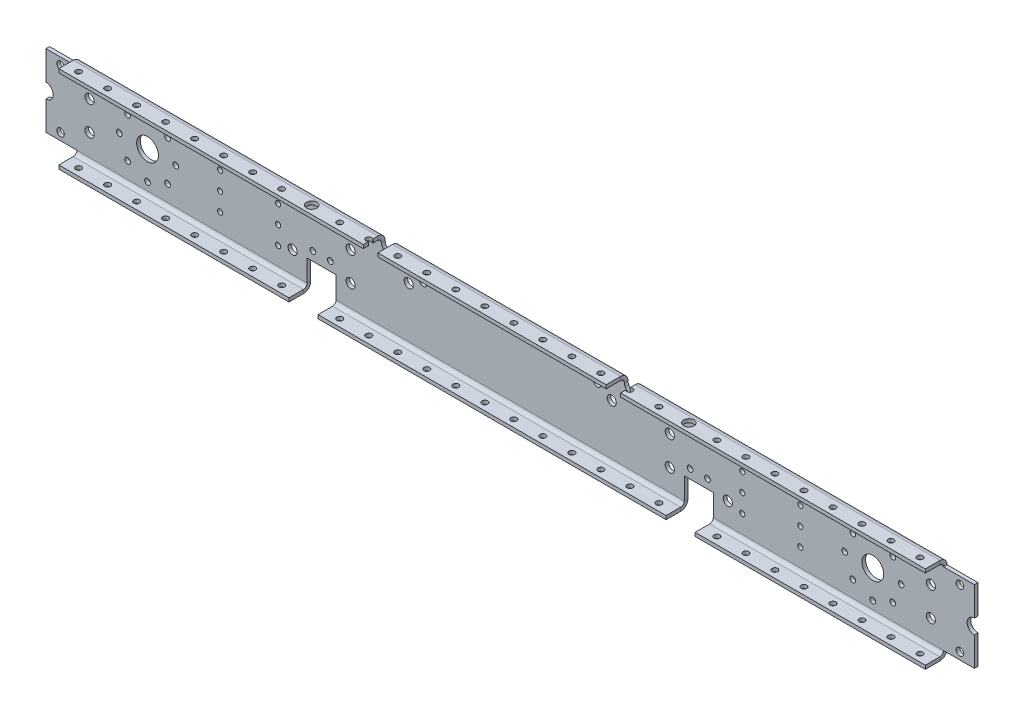
from build123d import *

# Parameters (mm, degrees)
SKETCH11_W                 = 812.8
SKETCH11_H                 = 63.5
BASE_FLANGE1_DEPTH         = 3.175
SKETCH16_W                 = 25.4
SKETCH16_H                 = 19.05
CUT_EXTRUDE1_DEPTH         = 816.802024467
SKETCH17_W                 = 25.4
SKETCH17_H                 = 19.05
CUT_EXTRUDE2_DEPTH         = 816.802024467
M18_CLEARANCE_HOLE1_D      = 19.05
F_5_0_5_DIAMETER_HOLE1_D   = 5
M4_CLEARANCE_HOLE1_D       = 4.4958
F_6_6_6_6_DIAMETER_HOLE1_D = 6.6
F_8_0_8_DIAMETER_HOLE1_D   = 8
HOLE1_D                    = 12.7
EDGE_FLANGE1_DEPTH         = 201.549
EDGE_FLANGE1_START         = 3.175
EDGE_FLANGE1_PROFILE_W     = 201.549
EDGE_FLANGE1_PROFILE_H     = 12.7
EDGE_FLANGE1_PROFILE_R     = 2.5
EDGE_FLANGE1_FLAT_DEPTH    = 3.175
EDGE_FLANGE2_DEPTH         = 304.8
EDGE_FLANGE2_START         = 3.175
EDGE_FLANGE2_PROFILE_W     = 304.8
EDGE_FLANGE2_PROFILE_H     = 12.7
EDGE_FLANGE2_PROFILE_R     = 2.5
EDGE_FLANGE2_FLAT_DEPTH    = 3.175
EDGE_FLANGE3_DEPTH         = 201.549
EDGE_FLANGE3_START         = 3.175
EDGE_FLANGE3_PROFILE_W     = 201.549
EDGE_FLANGE3_PROFILE_H     = 12.7
EDGE_FLANGE3_PROFILE_R     = 2.5
EDGE_FLANGE3_FLAT_DEPTH    = 3.175
EDGE_FLANGE4_DEPTH         = 266.7
EDGE_FLANGE4_START         = 3.175
EDGE_FLANGE4_PROFILE_R     = 2.5
EDGE_FLANGE4_PROFILE_R_2   = 4.5
EDGE_FLANGE4_FLAT_DEPTH    = 3.175
EDGE_FLANGE5_DEPTH         = 199.898
EDGE_FLANGE5_START         = 3.175
EDGE_FLANGE5_PROFILE_W     = 199.898
EDGE_FLANGE5_PROFILE_H     = 12.7
EDGE_FLANGE5_PROFILE_R     = 2.5
EDGE_FLANGE5_FLAT_DEPTH    = 3.175
EDGE_FLANGE6_DEPTH         = 266.7
EDGE_FLANGE6_START         = 3.175
EDGE_FLANGE6_PROFILE_R     = 4.5
EDGE_FLANGE6_PROFILE_R_2   = 2.5
EDGE_FLANGE6_FLAT_DEPTH    = 3.175


# Sheet-metal steps are written as plain solids
with BuildPart() as part:
    # Sketch11 → Base-Flange1 (new body)
    with BuildSketch(Plane.XY.offset(3.175)):
        with Locations((406.4, -38.1)):
            Rectangle(SKETCH11_W, SKETCH11_H)
    extrude(amount=-BASE_FLANGE1_DEPTH)

    # Sketch16 → Cut-Extrude1 (cut, through all)
    with BuildSketch(Plane(origin=(0, 0, 0), x_dir=(-1, 0, 0), z_dir=(0, 0, -1))):
        with Locations((-241.3, -60.325)):
            Rectangle(SKETCH16_W, SKETCH16_H)
    extrude(amount=-CUT_EXTRUDE1_DEPTH, mode=Mode.SUBTRACT)

    # Sketch17 → Cut-Extrude2 (cut, through all)
    with BuildSketch(Plane(origin=(0, 0, 0), x_dir=(-1, 0, 0), z_dir=(0, 0, -1))):
        with Locations((-571.5, -60.325)):
            Rectangle(SKETCH17_W, SKETCH17_H)
    extrude(amount=-CUT_EXTRUDE2_DEPTH, mode=Mode.SUBTRACT)

    # M18 Clearance Hole1 (through all)
    with Locations(Plane(origin=(0, 0, 0), x_dir=(-1, 0, 0), z_dir=(0, 0, -1))):
        with Locations((-723.9, -38.1), (-88.9, -38.1)):
            Hole(M18_CLEARANCE_HOLE1_D / 2)

    # Ø5.0 (5) Diameter Hole1 (through all)
    with Locations(Plane(origin=(0, 0, 0), x_dir=(-1, 0, 0), z_dir=(0, 0, -1))):
        with Locations((-233.68, -42.8625), (-248.92, -42.8625), (-699.15, -38.1), (-748.65, -38.1), (-741.400892834, -55.600892834), (-706.399107166, -20.599107166), (-706.399107166, -55.600892834), (-741.400892834, -20.599107166), (-723.9, -62.85), (-723.9, -13.35), (-113.65, -38.1), (-64.15, -38.1), (-71.399107166, -55.600892834), (-106.400892834, -20.599107166), (-106.400892834, -55.600892834), (-71.399107166, -20.599107166), (-88.9, -62.85), (-88.9, -13.35), (-563.88, -42.8625), (-579.12, -42.8625)):
            Hole(F_5_0_5_DIAMETER_HOLE1_D / 2)

    # M4 Clearance Hole1 (through all)
    with Locations(Plane(origin=(0, 0, 0), x_dir=(-1, 0, 0), z_dir=(0, 0, -1))):
        with Locations((-152.4, -38.1), (-203.2, -38.1), (-152.4, -22.225), (-152.4, -53.975), (-203.2, -53.975), (-203.2, -22.225), (-609.6, -22.225), (-609.6, -53.975), (-660.4, -53.975), (-660.4, -22.225), (-609.6, -38.1), (-660.4, -38.1)):
            Hole(M4_CLEARANCE_HOLE1_D / 2)

    # Ø6.6 (6.6) Diameter Hole1 (through all)
    with Locations(Plane(origin=(0, 0, 0), x_dir=(-1, 0, 0), z_dir=(0, 0, -1))):
        with Locations((-800.1, -63.5), (-482.6, -18.218319194), (-800.1, -12.7), (-12.7, -63.5), (-330.2, -18.218319194), (-12.7, -12.7)):
            Hole(F_6_6_6_6_DIAMETER_HOLE1_D / 2)

    # Ø8.0 (8) Diameter Hole1 (through all)
    with Locations(Plane(origin=(0, 0, 0), x_dir=(-1, 0, 0), z_dir=(0, 0, -1))):
        with Locations((-596.9, -50.8), (-317.5, -25.4), (-38.1, -25.4), (-215.9, -50.8), (-495.3, -25.4), (-774.7, -50.8), (-546.1, -50.8), (-266.7, -25.4), (-38.1, -50.8), (-266.7, -50.8), (-546.1, -25.4), (-774.7, -25.4)):
            Hole(F_8_0_8_DIAMETER_HOLE1_D / 2)

    # Hole1 (through all)
    with Locations(Plane.XY.offset(3.175)):
        with Locations((512.699, -6.35), (300.101, -6.35), (0, -38.1), (812.8, -38.1)):
            Hole(HOLE1_D / 2)

    # Edge-Flange1 bend section (across the edge) → Edge-Flange1 (add)
    with BuildSketch(Plane(origin=(584.2, -73.025, 3.175), x_dir=(0, 1, 0), z_dir=(1, 0, 0))):
        with BuildLine():
            Line((-3.175, 3.175), (0, 3.175))
            ThreePointArc((0, 3.175), (0.92993597, 0.92993597), (3.175, 0))
            Line((3.175, 0), (3.175, -3.175))
            ThreePointArc((3.175, -3.175), (-1.315128061, -1.315128061), (-3.175, 3.175))
        make_face()
    extrude(amount=EDGE_FLANGE1_DEPTH)

    # Edge-Flange1 profile (on flange) → Edge-Flange1 flat (add)
    with BuildSketch(Plane(origin=(0, -73.025, 3.175), x_dir=(1, 0, 0), z_dir=(0, -1, 0)).offset(EDGE_FLANGE1_START)):
        with Locations((684.9745, 9.525)):
            Rectangle(EDGE_FLANGE1_PROFILE_W, EDGE_FLANGE1_PROFILE_H)
        with Locations((774.7, 9.525)):
            Circle(EDGE_FLANGE1_PROFILE_R, mode=Mode.SUBTRACT)
        with Locations((749.3, 9.525)):
            Circle(EDGE_FLANGE1_PROFILE_R, mode=Mode.SUBTRACT)
        with Locations((723.9, 9.525)):
            Circle(EDGE_FLANGE1_PROFILE_R, mode=Mode.SUBTRACT)
        with Locations((698.5, 9.525)):
            Circle(EDGE_FLANGE1_PROFILE_R, mode=Mode.SUBTRACT)
        with Locations((673.1, 9.525)):
            Circle(EDGE_FLANGE1_PROFILE_R, mode=Mode.SUBTRACT)
        with Locations((647.7, 9.525)):
            Circle(EDGE_FLANGE1_PROFILE_R, mode=Mode.SUBTRACT)
        with Locations((622.3, 9.525)):
            Circle(EDGE_FLANGE1_PROFILE_R, mode=Mode.SUBTRACT)
        with Locations((596.9, 9.525)):
            Circle(EDGE_FLANGE1_PROFILE_R, mode=Mode.SUBTRACT)
    extrude(amount=-EDGE_FLANGE1_FLAT_DEPTH)

    # Edge-Flange2 bend section (across the edge) → Edge-Flange2 (add)
    with BuildSketch(Plane(origin=(254, -73.025, 3.175), x_dir=(0, 1, 0), z_dir=(1, 0, 0))):
        with BuildLine():
            Line((-3.175, 3.175), (0, 3.175))
            ThreePointArc((0, 3.175), (0.92993597, 0.92993597), (3.175, 0))
            Line((3.175, 0), (3.175, -3.175))
            ThreePointArc((3.175, -3.175), (-1.315128061, -1.315128061), (-3.175, 3.175))
        make_face()
    extrude(amount=EDGE_FLANGE2_DEPTH)

    # Edge-Flange2 profile (on flange) → Edge-Flange2 flat (add)
    with BuildSketch(Plane(origin=(0, -73.025, 3.175), x_dir=(1, 0, 0), z_dir=(0, -1, 0)).offset(EDGE_FLANGE2_START)):
        with Locations((406.4, 9.525)):
            Rectangle(EDGE_FLANGE2_PROFILE_W, EDGE_FLANGE2_PROFILE_H)
        with Locations((546.1, 9.525)):
            Circle(EDGE_FLANGE2_PROFILE_R, mode=Mode.SUBTRACT)
        with Locations((520.7, 9.525)):
            Circle(EDGE_FLANGE2_PROFILE_R, mode=Mode.SUBTRACT)
        with Locations((495.3, 9.525)):
            Circle(EDGE_FLANGE2_PROFILE_R, mode=Mode.SUBTRACT)
        with Locations((469.9, 9.525)):
            Circle(EDGE_FLANGE2_PROFILE_R, mode=Mode.SUBTRACT)
        with Locations((444.5, 9.525)):
            Circle(EDGE_FLANGE2_PROFILE_R, mode=Mode.SUBTRACT)
        with Locations((419.1, 9.525)):
            Circle(EDGE_FLANGE2_PROFILE_R, mode=Mode.SUBTRACT)
        with Locations((393.7, 9.525)):
            Circle(EDGE_FLANGE2_PROFILE_R, mode=Mode.SUBTRACT)
        with Locations((368.3, 9.525)):
            Circle(EDGE_FLANGE2_PROFILE_R, mode=Mode.SUBTRACT)
        with Locations((342.9, 9.525)):
            Circle(EDGE_FLANGE2_PROFILE_R, mode=Mode.SUBTRACT)
        with Locations((317.5, 9.525)):
            Circle(EDGE_FLANGE2_PROFILE_R, mode=Mode.SUBTRACT)
        with Locations((292.1, 9.525)):
            Circle(EDGE_FLANGE2_PROFILE_R, mode=Mode.SUBTRACT)
        with Locations((266.7, 9.525)):
            Circle(EDGE_FLANGE2_PROFILE_R, mode=Mode.SUBTRACT)
    extrude(amount=-EDGE_FLANGE2_FLAT_DEPTH)

    # Edge-Flange3 bend section (across the edge) → Edge-Flange3 (add)
    with BuildSketch(Plane(origin=(27.051, -73.025, 3.175), x_dir=(0, 1, 0), z_dir=(1, 0, 0))):
        with BuildLine():
            Line((-3.175, 3.175), (0, 3.175))
            ThreePointArc((0, 3.175), (0.92993597, 0.92993597), (3.175, 0))
            Line((3.175, 0), (3.175, -3.175))
            ThreePointArc((3.175, -3.175), (-1.315128061, -1.315128061), (-3.175, 3.175))
        make_face()
    extrude(amount=EDGE_FLANGE3_DEPTH)

    # Edge-Flange3 profile (on flange) → Edge-Flange3 flat (add)
    with BuildSketch(Plane(origin=(0, -73.025, 3.175), x_dir=(1, 0, 0), z_dir=(0, -1, 0)).offset(EDGE_FLANGE3_START)):
        with Locations((127.8255, 9.525)):
            Rectangle(EDGE_FLANGE3_PROFILE_W, EDGE_FLANGE3_PROFILE_H)
        with Locations((215.9, 9.525)):
            Circle(EDGE_FLANGE3_PROFILE_R, mode=Mode.SUBTRACT)
        with Locations((190.5, 9.525)):
            Circle(EDGE_FLANGE3_PROFILE_R, mode=Mode.SUBTRACT)
        with Locations((165.1, 9.525)):
            Circle(EDGE_FLANGE3_PROFILE_R, mode=Mode.SUBTRACT)
        with Locations((139.7, 9.525)):
            Circle(EDGE_FLANGE3_PROFILE_R, mode=Mode.SUBTRACT)
        with Locations((114.3, 9.525)):
            Circle(EDGE_FLANGE3_PROFILE_R, mode=Mode.SUBTRACT)
        with Locations((88.9, 9.525)):
            Circle(EDGE_FLANGE3_PROFILE_R, mode=Mode.SUBTRACT)
        with Locations((63.5, 9.525)):
            Circle(EDGE_FLANGE3_PROFILE_R, mode=Mode.SUBTRACT)
        with Locations((38.1, 9.525)):
            Circle(EDGE_FLANGE3_PROFILE_R, mode=Mode.SUBTRACT)
    extrude(amount=-EDGE_FLANGE3_FLAT_DEPTH)

    # Edge-Flange4 bend section (across the edge) → Edge-Flange4 (add)
    with BuildSketch(Plane(origin=(293.751, -3.175, 3.175), x_dir=(0, -1, 0), z_dir=(-1, 0, 0))):
        with BuildLine():
            Line((-3.175, 3.175), (0, 3.175))
            ThreePointArc((0, 3.175), (0.92993597, 0.92993597), (3.175, 0))
            Line((3.175, 0), (3.175, -3.175))
            ThreePointArc((3.175, -3.175), (-1.315128061, -1.315128061), (-3.175, 3.175))
        make_face()
    extrude(amount=EDGE_FLANGE4_DEPTH)

    # Edge-Flange4 profile (on flange) → Edge-Flange4 flat (add)
    with BuildSketch(Plane(origin=(0, -3.175, 3.175), x_dir=(-1, 0, 0), z_dir=(0, 1, 0)).offset(EDGE_FLANGE4_START)):
        with BuildLine():
            Line((-27.051, 3.175), (-27.051, 15.875))
            Line((-27.051, 15.875), (-293.751, 15.875))
            Line((-293.751, 15.875), (-293.751, 11.402285008))
            ThreePointArc((-293.751, 11.402285008), (-289.6, 9.525), (-293.751, 7.647714992))
            Line((-293.751, 7.647714992), (-293.751, 3.175))
            Line((-293.751, 3.175), (-27.051, 3.175))
        make_face()
        with Locations((-38.1, 9.525)):
            Circle(EDGE_FLANGE4_PROFILE_R, mode=Mode.SUBTRACT)
        with Locations((-63.5, 9.525)):
            Circle(EDGE_FLANGE4_PROFILE_R, mode=Mode.SUBTRACT)
        with Locations((-88.9, 9.525)):
            Circle(EDGE_FLANGE4_PROFILE_R, mode=Mode.SUBTRACT)
        with Locations((-114.3, 9.525)):
            Circle(EDGE_FLANGE4_PROFILE_R, mode=Mode.SUBTRACT)
        with Locations((-139.7, 9.525)):
            Circle(EDGE_FLANGE4_PROFILE_R, mode=Mode.SUBTRACT)
        with Locations((-165.1, 9.525)):
            Circle(EDGE_FLANGE4_PROFILE_R, mode=Mode.SUBTRACT)
        with Locations((-190.5, 9.525)):
            Circle(EDGE_FLANGE4_PROFILE_R, mode=Mode.SUBTRACT)
        with Locations((-215.9, 9.525)):
            Circle(EDGE_FLANGE4_PROFILE_R, mode=Mode.SUBTRACT)
        with Locations((-241.3, 8.693319194)):
            Circle(EDGE_FLANGE4_PROFILE_R_2, mode=Mode.SUBTRACT)
        with Locations((-266.7, 9.525)):
            Circle(EDGE_FLANGE4_PROFILE_R, mode=Mode.SUBTRACT)
    extrude(amount=-EDGE_FLANGE4_FLAT_DEPTH)

    # Edge-Flange5 bend section (across the edge) → Edge-Flange5 (add)
    with BuildSketch(Plane(origin=(506.349, -3.175, 3.175), x_dir=(0, -1, 0), z_dir=(-1, 0, 0))):
        with BuildLine():
            Line((-3.175, 3.175), (0, 3.175))
            ThreePointArc((0, 3.175), (0.92993597, 0.92993597), (3.175, 0))
            Line((3.175, 0), (3.175, -3.175))
            ThreePointArc((3.175, -3.175), (-1.315128061, -1.315128061), (-3.175, 3.175))
        make_face()
    extrude(amount=EDGE_FLANGE5_DEPTH)

    # Edge-Flange5 profile (on flange) → Edge-Flange5 flat (add)
    with BuildSketch(Plane(origin=(0, -3.175, 3.175), x_dir=(-1, 0, 0), z_dir=(0, 1, 0)).offset(EDGE_FLANGE5_START)):
        with Locations((-406.4, 9.525)):
            Rectangle(EDGE_FLANGE5_PROFILE_W, EDGE_FLANGE5_PROFILE_H)
        with Locations((-317.5, 9.525)):
            Circle(EDGE_FLANGE5_PROFILE_R, mode=Mode.SUBTRACT)
        with Locations((-342.9, 9.525)):
            Circle(EDGE_FLANGE5_PROFILE_R, mode=Mode.SUBTRACT)
        with Locations((-368.3, 9.525)):
            Circle(EDGE_FLANGE5_PROFILE_R, mode=Mode.SUBTRACT)
        with Locations((-393.7, 9.525)):
            Circle(EDGE_FLANGE5_PROFILE_R, mode=Mode.SUBTRACT)
        with Locations((-419.1, 9.525)):
            Circle(EDGE_FLANGE5_PROFILE_R, mode=Mode.SUBTRACT)
        with Locations((-444.5, 9.525)):
            Circle(EDGE_FLANGE5_PROFILE_R, mode=Mode.SUBTRACT)
        with Locations((-469.9, 9.525)):
            Circle(EDGE_FLANGE5_PROFILE_R, mode=Mode.SUBTRACT)
        with Locations((-495.3, 9.525)):
            Circle(EDGE_FLANGE5_PROFILE_R, mode=Mode.SUBTRACT)
    extrude(amount=-EDGE_FLANGE5_FLAT_DEPTH)

    # Edge-Flange6 bend section (across the edge) → Edge-Flange6 (add)
    with BuildSketch(Plane(origin=(785.749, -3.175, 3.175), x_dir=(0, -1, 0), z_dir=(-1, 0, 0))):
        with BuildLine():
            Line((-3.175, 3.175), (0, 3.175))
            ThreePointArc((0, 3.175), (0.92993597, 0.92993597), (3.175, 0))
            Line((3.175, 0), (3.175, -3.175))
            ThreePointArc((3.175, -3.175), (-1.315128061, -1.315128061), (-3.175, 3.175))
        make_face()
    extrude(amount=EDGE_FLANGE6_DEPTH)

    # Edge-Flange6 profile (on flange) → Edge-Flange6 flat (add)
    with BuildSketch(Plane(origin=(0, -3.175, 3.175), x_dir=(-1, 0, 0), z_dir=(0, 1, 0)).offset(EDGE_FLANGE6_START)):
        with BuildLine():
            Line((-785.749, 3.175), (-519.049, 3.175))
            Line((-519.049, 3.175), (-519.049, 7.647714992))
            ThreePointArc((-519.049, 7.647714992), (-523.2, 9.525), (-519.049, 11.402285008))
            Line((-519.049, 11.402285008), (-519.049, 15.875))
            Line((-519.049, 15.875), (-785.749, 15.875))
            Line((-785.749, 15.875), (-785.749, 3.175))
        make_face()
        with Locations((-571.5, 8.693319194)):
            Circle(EDGE_FLANGE6_PROFILE_R, mode=Mode.SUBTRACT)
        with Locations((-546.1, 9.525)):
            Circle(EDGE_FLANGE6_PROFILE_R_2, mode=Mode.SUBTRACT)
        with Locations((-596.9, 9.525)):
            Circle(EDGE_FLANGE6_PROFILE_R_2, mode=Mode.SUBTRACT)
        with Locations((-622.3, 9.525)):
            Circle(EDGE_FLANGE6_PROFILE_R_2, mode=Mode.SUBTRACT)
        with Locations((-647.7, 9.525)):
            Circle(EDGE_FLANGE6_PROFILE_R_2, mode=Mode.SUBTRACT)
        with Locations((-673.1, 9.525)):
            Circle(EDGE_FLANGE6_PROFILE_R_2, mode=Mode.SUBTRACT)
        with Locations((-698.5, 9.525)):
            Circle(EDGE_FLANGE6_PROFILE_R_2, mode=Mode.SUBTRACT)
        with Locations((-723.9, 9.525)):
            Circle(EDGE_FLANGE6_PROFILE_R_2, mode=Mode.SUBTRACT)
        with Locations((-749.3, 9.525)):
            Circle(EDGE_FLANGE6_PROFILE_R_2, mode=Mode.SUBTRACT)
        with Locations((-774.7, 9.525)):
            Circle(EDGE_FLANGE6_PROFILE_R_2, mode=Mode.SUBTRACT)
    extrude(amount=-EDGE_FLANGE6_FLAT_DEPTH)


solid = part.part
